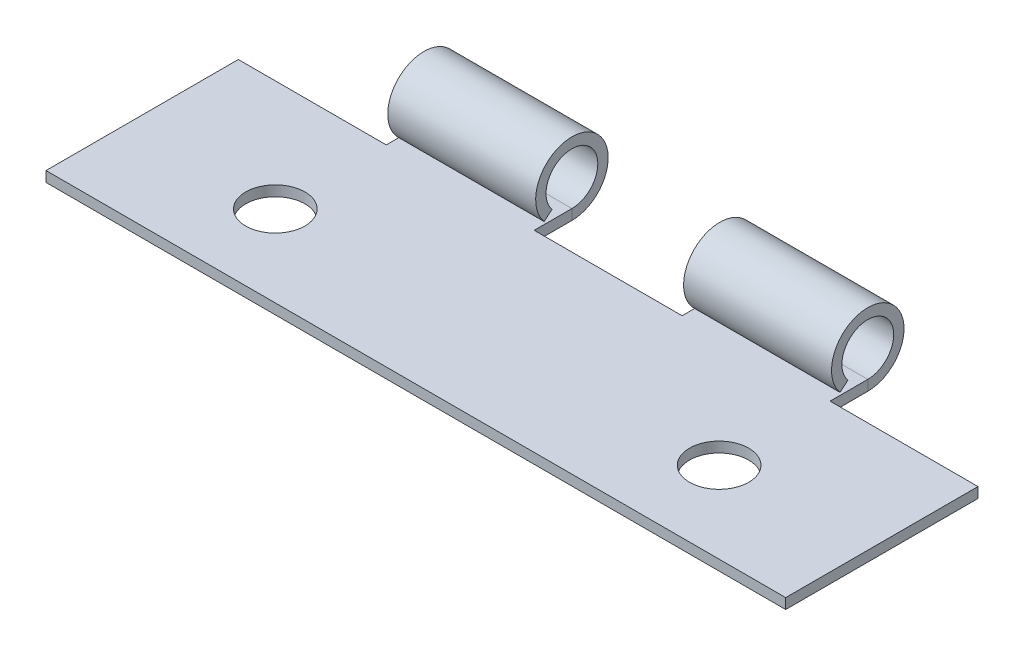
from build123d import *

# Parameters (mm, degrees)
SKETCH_1_R             = 2
SM_BASE_FLANGE_1_DEPTH = 0.7
OTHER_START            = -15
OTHER_2_DEPTH          = 30
OTHER_2_2_DEPTH        = 10
OTHER_START_2          = 5
OTHER_2_3_DEPTH        = 10


# Read off the part's stored shape, not the designer's step: 褶边2
# Sheet-metal steps are written as plain solids
with BuildPart() as part:
    # Sketch 1 → 基体-法兰1 (new body)
    with BuildSketch(Plane(origin=(0, 0, 0), x_dir=(1, 0, 0), z_dir=(0, 1, 0))):
        Polygon((-25, 0), (25, 0), (25, 13), (15, 13), (15, 18), (5, 18), (5, 13), (-5, 13), (-5, 18), (-15, 18), (-15, 13), (-25, 13), align=None)
        with Locations(Location((-15, 5.5, 0), (0, 0, 270))):
            Circle(SKETCH_1_R, mode=Mode.SUBTRACT)
        with Locations(Location((15, 5.5, 0), (0, 0, 90))):
            Circle(SKETCH_1_R, mode=Mode.SUBTRACT)
    extrude(amount=-SM_BASE_FLANGE_1_DEPTH)

    # Other 2 outline → Other 2 (cut)
    with BuildSketch(Plane.YZ.offset(OTHER_START)):
        with BuildLine():
            Line((0, -18), (0, -17.264642819))
            ThreePointArc((0, -17.264642819), (-0.518259244, -16.476012959), (-0.7, -15.55))
            Line((-0.7, -15.55), (-0.7, -18))
            Line((-0.7, -18), (0, -18))
        make_face()
    extrude(amount=OTHER_2_DEPTH, mode=Mode.SUBTRACT)

    # Other 2 2 outline → Other 2 2 (add)
    with BuildSketch(Plane.YZ.offset(OTHER_START)):
        with BuildLine():
            Line((0.175170356, -13.673191114), (0.625121683, -14.209422225))
            ThreePointArc((0.625121683, -14.209422225), (3.336038627, -16.289581958), (0, -15.55))
            Line((0, -15.55), (0, -17.264642819))
            ThreePointArc((0, -17.264642819), (4.197091003, -15.669355023), (0.175170356, -13.673191114))
        make_face()
    extrude(amount=OTHER_2_2_DEPTH)

    # Other 2 3 outline → Other 2 3 (add)
    with BuildSketch(Plane.YZ.offset(OTHER_START_2)):
        with BuildLine():
            Line((0.175170356, -13.673191114), (0.625121683, -14.209422225))
            ThreePointArc((0.625121683, -14.209422225), (3.336038627, -16.289581958), (0, -15.55))
            Line((0, -15.55), (0, -17.264642819))
            ThreePointArc((0, -17.264642819), (4.197091003, -15.669355023), (0.175170356, -13.673191114))
        make_face()
    extrude(amount=OTHER_2_3_DEPTH)


solid = part.part
